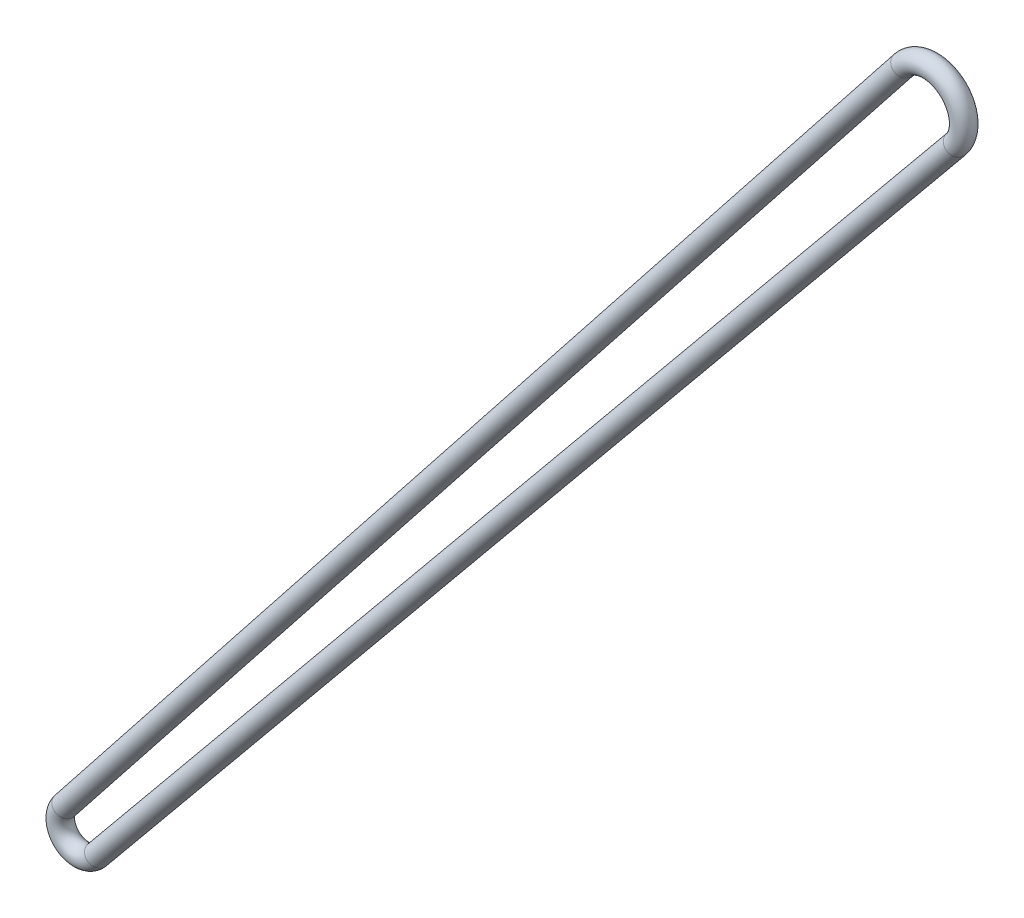
from build123d import *

# Parameters (mm, degrees)
SWEEP_19_PROFILE_R = 1.5


with BuildPart() as part:
    # 扫描19: sweep along a path in 草图2
    with BuildLine(Plane.XY) as sweep_19_path:
        Line((-2.431721314, 1.9226886), (121.937733632, 159.219015395))
        ThreePointArc((121.937733632, 159.219015395), (128.997997432, 160.01047761), (129.722529907, 152.943031816))
        Line((129.722529907, 152.943031816), (2.394852377, -1.968421219))
        ThreePointArc((2.394852377, -1.968421219), (-1.945642242, -2.413395174), (-2.431721314, 1.9226886))
    # 扫描19 profile (on start of the path) → 扫描19 (sweep)
    with BuildSketch(Plane(origin=(-2.431721314, 1.9226886, 0), x_dir=(0.7844262302076608, -0.6202221290490998, 0), z_dir=(0.6202221290490998, 0.7844262302076608, 0))):
        Circle(SWEEP_19_PROFILE_R)
    sweep(path=sweep_19_path.line)


solid = part.part
